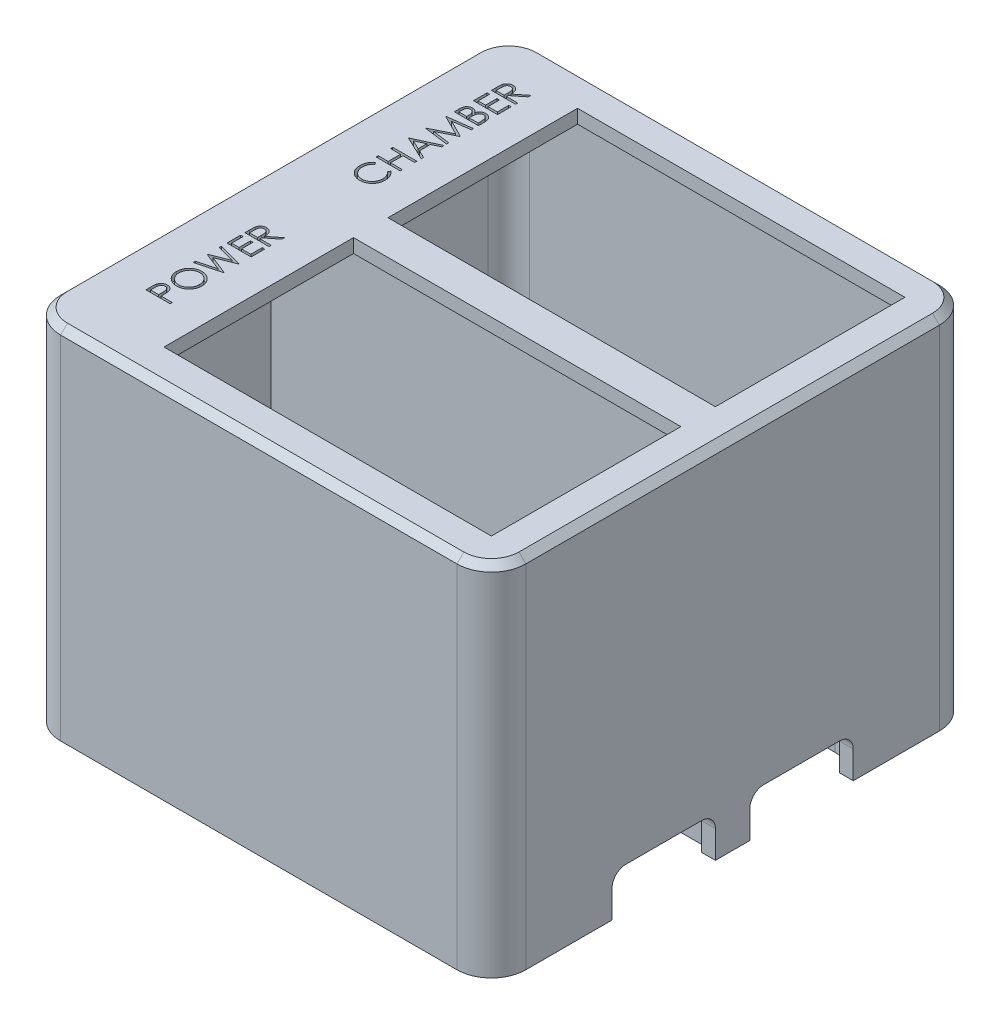
from build123d import *

# Parameters (mm, degrees)
SKETCH2_W           = 67.5
SKETCH2_H           = 70
SKETCH2_W_2         = 47.5
SKETCH2_H_2         = 27.5
BOSS_EXTRUDE1_DEPTH = 2
SKETCH3_W           = 67.5
SKETCH3_H           = 70
SKETCH3_W_2         = 63.5
SKETCH3_H_2         = 31.5
BOSS_EXTRUDE2_DEPTH = 50
FILLET1_R           = 3
FILLET2_R           = 5
SKETCH4_W           = 15
SKETCH4_H           = 6
CUT_EXTRUDE1_DEPTH  = 4
CHAMFER1_SIZE       = 1
SKETCH6_W           = 15
SKETCH6_H           = 8
SKETCH6_R           = 1.75
BOSS_EXTRUDE3_DEPTH = 2.5
FILLET4_START       = -51
FILLET4_DEPTH       = 4
FILLET4_START_2     = -50
FILLET4_2_DEPTH     = 2.5
CUT_EXTRUDE2_DEPTH  = 1
FILLET5_R           = 2


with BuildPart() as part:
    # Sketch2 → Boss-Extrude1 (new body)
    with BuildSketch(Plane(origin=(0, 0, 0), x_dir=(1, 0, 0), z_dir=(0, 1, 0))):
        Rectangle(SKETCH2_W, SKETCH2_H)
        with Locations((5, -16.25)):
            Rectangle(SKETCH2_W_2, SKETCH2_H_2, mode=Mode.SUBTRACT)
        with Locations((5, 16.25)):
            Rectangle(SKETCH2_W_2, SKETCH2_H_2, mode=Mode.SUBTRACT)
    extrude(amount=BOSS_EXTRUDE1_DEPTH)

    # Sketch3 → Boss-Extrude2 (add)
    with BuildSketch(Plane.XZ):
        Rectangle(SKETCH3_W, SKETCH3_H)
        with Locations((0, -17.25)):
            Rectangle(SKETCH3_W_2, SKETCH3_H_2, mode=Mode.SUBTRACT)
        with Locations((0, 17.25)):
            Rectangle(SKETCH3_W_2, SKETCH3_H_2, mode=Mode.SUBTRACT)
    extrude(amount=BOSS_EXTRUDE2_DEPTH)

    # Fillet1
    fillet1_edges = [part.edges().sort_by_distance(p)[0] for p in [
        (-31.75, -25, -33),
        (31.75, -25, -33),
        (31.75, -25, 33),
        (-31.75, -25, 33),
    ]]
    fillet(fillet1_edges, radius=FILLET1_R)

    # Fillet2
    fillet2_edges = [part.edges().sort_by_distance(p)[0] for p in [
        (33.75, -24, 35),
        (-33.75, -24, 35),
        (-33.75, -24, -35),
        (33.75, -24, -35),
    ]]
    fillet(fillet2_edges, radius=FILLET2_R)

    # Sketch4 → Cut-Extrude1 (cut)
    with BuildSketch(Plane(origin=(33.75, 0, 1.75), x_dir=(0, 0, 1), z_dir=(-1, 0, 0))):
        with Locations((8.25, -47)):
            Rectangle(SKETCH4_W, SKETCH4_H)
        with Locations((-11.75, -47)):
            Rectangle(SKETCH4_W, SKETCH4_H)
    extrude(amount=CUT_EXTRUDE1_DEPTH, mode=Mode.SUBTRACT)

    # Chamfer1
    chamfer1_edges = [part.edges().sort_by_distance(p)[0] for p in [
        (0, 2, 35),
        (-33.75, 2, 0),
        (33.75, 2, 0),
        (0, 2, -35),
        (32.285533906, 2, 33.535533906),
        (32.285533906, 2, -33.535533906),
        (-32.285533906, 2, -33.535533906),
        (-32.285533906, 2, 33.535533906),
    ]]
    chamfer(chamfer1_edges, length=CHAMFER1_SIZE)

    # Sketch6 → Boss-Extrude3 (add)
    # profile 1 of 2: a face of its own
    with BuildSketch(Plane.XZ.offset(50)):
        with Locations((-26.25, 23.75)):
            Rectangle(SKETCH6_W, SKETCH6_H)
        with Locations(Location((-23.75, 23.75, 0), (0, 0, 270))):
            Circle(SKETCH6_R, mode=Mode.SUBTRACT)
    # profile 2 of 2: a face of its own
    with BuildSketch(Plane.XZ.offset(50)):
        with Locations((26.25, 23.75)):
            Rectangle(SKETCH6_W, SKETCH6_H)
        with Locations(Location((23.75, 23.75, 0), (0, 0, 270))):
            Circle(SKETCH6_R, mode=Mode.SUBTRACT)
    boss_extrude3 = extrude(amount=-BOSS_EXTRUDE3_DEPTH)

    # Mirror1: Boss-Extrude3 across plane
    add(boss_extrude3.mirror(Plane.XY))

    # Fillet4: read off the stored shape, not the designer's step
    # Fillet4 outline → Fillet4 (cut)
    with BuildSketch(Plane(origin=(0, 0, 0), x_dir=(1, 0, 0), z_dir=(0, 1, 0)).offset(FILLET4_START)):
        with BuildLine():
            Line((18.75, 19.75), (21.75, 19.75))
            ThreePointArc((21.75, 19.75), (19.628679656, 20.628679656), (18.75, 22.75))
            Line((18.75, 22.75), (18.75, 19.75))
        make_face()
        with BuildLine():
            Line((18.75, 27.75), (18.75, 24.75))
            ThreePointArc((18.75, 24.75), (19.628679656, 26.871320344), (21.75, 27.75))
            Line((21.75, 27.75), (18.75, 27.75))
        make_face()
        with BuildLine():
            Line((-18.75, 27.75), (-21.75, 27.75))
            ThreePointArc((-21.75, 27.75), (-19.628679656, 26.871320344), (-18.75, 24.75))
            Line((-18.75, 24.75), (-18.75, 27.75))
        make_face()
        with BuildLine():
            Line((-18.75, 19.75), (-18.75, 22.75))
            ThreePointArc((-18.75, 22.75), (-19.628679656, 20.628679656), (-21.75, 19.75))
            Line((-21.75, 19.75), (-18.75, 19.75))
        make_face()
        with BuildLine():
            ThreePointArc((18.75, -22.75), (19.628679656, -20.628679656), (21.75, -19.75))
            Line((21.75, -19.75), (18.75, -19.75))
            Line((18.75, -19.75), (18.75, -22.75))
        make_face()
        with BuildLine():
            ThreePointArc((21.75, -27.75), (19.628679656, -26.871320344), (18.75, -24.75))
            Line((18.75, -24.75), (18.75, -27.75))
            Line((18.75, -27.75), (21.75, -27.75))
        make_face()
        with BuildLine():
            ThreePointArc((-21.75, -19.75), (-19.628679656, -20.628679656), (-18.75, -22.75))
            Line((-18.75, -22.75), (-18.75, -19.75))
            Line((-18.75, -19.75), (-21.75, -19.75))
        make_face()
        with BuildLine():
            Line((-18.75, -27.75), (-18.75, -24.75))
            ThreePointArc((-18.75, -24.75), (-19.628679656, -26.871320344), (-21.75, -27.75))
            Line((-21.75, -27.75), (-18.75, -27.75))
        make_face()
    extrude(amount=FILLET4_DEPTH, mode=Mode.SUBTRACT)

    # Fillet4 2 outline → Fillet4 2 (add)
    with BuildSketch(Plane(origin=(0, 0, 0), x_dir=(1, 0, 0), z_dir=(0, 1, 0)).offset(FILLET4_START_2)):
        with BuildLine():
            ThreePointArc((28.84526249, 19.75), (30.682379797, 19.121708245), (31.75, 17.5))
            Line((31.75, 17.5), (31.75, 19.75))
            Line((31.75, 19.75), (28.84526249, 19.75))
        make_face()
        with BuildLine():
            Line((28.84526249, 27.75), (31.75, 27.75))
            Line((31.75, 27.75), (31.75, 30))
            ThreePointArc((31.75, 30), (30.682379797, 28.378291755), (28.84526249, 27.75))
        make_face()
        with BuildLine():
            ThreePointArc((-28.84526249, 27.75), (-30.682379797, 28.378291755), (-31.75, 30))
            Line((-31.75, 30), (-31.75, 27.75))
            Line((-31.75, 27.75), (-28.84526249, 27.75))
        make_face()
        with BuildLine():
            Line((-28.75, 19.75), (-31.75, 19.75))
            Line((-31.75, 19.75), (-31.75, 16.75))
            ThreePointArc((-31.75, 16.75), (-30.871320344, 18.871320344), (-28.75, 19.75))
        make_face()
        with BuildLine():
            Line((31.75, -19.75), (31.75, -17.5))
            ThreePointArc((31.75, -17.5), (30.682379797, -19.121708245), (28.84526249, -19.75))
            Line((28.84526249, -19.75), (31.75, -19.75))
        make_face()
        with BuildLine():
            Line((31.75, -30), (31.75, -27.75))
            Line((31.75, -27.75), (28.84526249, -27.75))
            ThreePointArc((28.84526249, -27.75), (30.682379797, -28.378291755), (31.75, -30))
        make_face()
        with BuildLine():
            Line((-31.75, -19.75), (-28.75, -19.75))
            ThreePointArc((-28.75, -19.75), (-30.871320344, -18.871320344), (-31.75, -16.75))
            Line((-31.75, -16.75), (-31.75, -19.75))
        make_face()
        with BuildLine():
            ThreePointArc((-31.75, -30), (-30.682379797, -28.378291755), (-28.84526249, -27.75))
            Line((-28.84526249, -27.75), (-31.75, -27.75))
            Line((-31.75, -27.75), (-31.75, -30))
        make_face()
    extrude(amount=FILLET4_2_DEPTH)

    # Sketch7 → Cut-Extrude2 (cut)
    # profile 1 of 12: a face of its own
    with BuildSketch(Plane(origin=(0, 2, 0), x_dir=(1, 0, 0), z_dir=(0, 1, 0))):
        with BuildLine():
            Line((-27.25, 26.003205128), (-27.25, 26.703625801))
            add(Edge.make_bspline(
                [(-27.25, 26.703625801), (-27.249844414, 26.75036693), (-27.249545672, 26.840115074), (-27.247879909, 26.968688345), (-27.243105553, 27.085515442), (-27.23899697, 27.190535281), (-27.231505028, 27.283745936), (-27.224344381, 27.365433227), (-27.21497072, 27.435220924), (-27.206265297, 27.477466775), (-27.202323718, 27.496594551)],
                knots=[0, 0, 0, 0, 1.410062039, 2.707475311, 3.878576406, 4.937260626, 5.877586885, 6.699081471, 7.410979367, 8, 8, 8, 8], degree=3))
            add(Edge.make_bspline(
                [(-27.202323718, 27.496594551), (-27.195996936, 27.522201156), (-27.183478338, 27.572868106), (-27.157018985, 27.64581846), (-27.126398448, 27.715331719), (-27.090438053, 27.781125429), (-27.048850926, 27.842846791), (-27.002429037, 27.901219129), (-26.951266149, 27.956052964), (-26.894901045, 28.006632669), (-26.834534666, 28.052576801), (-26.770332688, 28.092876881), (-26.702560575, 28.126929708), (-26.631112765, 28.153652436), (-26.556778508, 28.176075742), (-26.478799111, 28.191141441), (-26.397434893, 28.200525899), (-26.342073564, 28.201452991), (-26.314002404, 28.201923077)],
                knots=[0, 0, 0, 0, 1.02737844, 2.032840108, 3.019645024, 3.985760442, 4.950801802, 5.916702504, 6.889791722, 7.870143693, 8.864820395, 9.842884691, 10.820524757, 11.815201459, 12.812418953, 13.84314332, 14.906358105, 16, 16, 16, 16], degree=3))
            add(Edge.make_bspline(
                [(-26.314002404, 28.201923077), (-26.267367299, 28.200454079), (-26.176370131, 28.197587683), (-26.04430925, 28.170862579), (-25.921119935, 28.12708606), (-25.806957297, 28.066762771), (-25.704046652, 27.989943295), (-25.613656197, 27.897618504), (-25.538016284, 27.789736892), (-25.485563479, 27.689307576), (-25.451970571, 27.600593377), (-25.428334212, 27.527560064), (-25.410072247, 27.447893086), (-25.393712115, 27.362355752), (-25.38136042, 27.270592096), (-25.372313826, 27.172822057), (-25.366659777, 27.068975905), (-25.365817772, 26.997636836), (-25.365384615, 26.9609375)],
                knots=[0, 0, 0, 0, 1.260483769, 2.459530307, 3.627416485, 4.787058657, 5.939039949, 7.08810263, 8.267026773, 9.491475466, 10.141966685, 10.831826277, 11.566392101, 12.351337768, 13.187381173, 14.07005841, 15.007169909, 16, 16, 16, 16], degree=3))
            Line((-25.365384615, 26.9609375), (-23.75, 28.246794872))
            Line((-23.75, 28.246794872), (-23.75, 27.858373397))
            Line((-23.75, 27.858373397), (-25.365384615, 26.572516026))
            Line((-25.365384615, 26.572516026), (-25.365384615, 26.317307692))
            Line((-25.365384615, 26.317307692), (-23.75, 26.317307692))
            Line((-23.75, 26.317307692), (-23.75, 26.003205128))
            Line((-23.75, 26.003205128), (-27.25, 26.003205128))
        make_face()
        with BuildLine():
            Line((-26.891025641, 26.317307692), (-25.724358974, 26.317307692))
            Line((-25.724358974, 26.317307692), (-25.719451122, 26.958133013))
            add(Edge.make_bspline(
                [(-25.719451122, 26.958133013), (-25.719437877, 26.988053056), (-25.719412206, 27.04604662), (-25.723406086, 27.129947232), (-25.72794905, 27.208067524), (-25.734899579, 27.280107677), (-25.743851764, 27.34610322), (-25.755067425, 27.406010213), (-25.768078178, 27.459962187), (-25.788424454, 27.522682008), (-25.819251682, 27.593546388), (-25.867131907, 27.668876742), (-25.924663519, 27.734973084), (-25.992349925, 27.788803646), (-26.06558868, 27.833904886), (-26.145129884, 27.864256227), (-26.228393298, 27.884484107), (-26.285601748, 27.886695555), (-26.314703526, 27.887820513)],
                knots=[0, 0, 0, 0, 1.146477201, 2.22219935, 3.21835465, 4.145220026, 4.995151787, 5.769831222, 6.480173269, 7.120302478, 8.295254187, 9.430763426, 10.528629691, 11.636497428, 12.733230534, 13.811001502, 14.886462612, 16, 16, 16, 16], degree=3))
            add(Edge.make_bspline(
                [(-26.314703526, 27.887820513), (-26.342847804, 27.886614922), (-26.398619495, 27.884225881), (-26.480309052, 27.864827979), (-26.557431576, 27.831665325), (-26.630086643, 27.788039707), (-26.695007947, 27.73328937), (-26.751158697, 27.670324838), (-26.797125816, 27.59915823), (-26.827677228, 27.533229217), (-26.845618725, 27.473828496), (-26.858659167, 27.42249946), (-26.86770972, 27.364217383), (-26.876282244, 27.299247313), (-26.883221934, 27.227465257), (-26.888008837, 27.148660831), (-26.890812263, 27.063322201), (-26.89095286, 27.004175537), (-26.891025641, 26.973557692)],
                knots=[0, 0, 0, 0, 1.100823979, 2.181431445, 3.263702604, 4.376021382, 5.48638238, 6.575013887, 7.666064109, 8.791843368, 9.405226397, 10.093019944, 10.863016055, 11.711746407, 12.658404307, 13.684961631, 14.801597923, 16, 16, 16, 16], degree=3))
            Line((-26.891025641, 26.973557692), (-26.891025641, 26.317307692))
        make_face(mode=Mode.SUBTRACT)
    # profile 2 of 12: a face of its own
    with BuildSketch(Plane(origin=(0, 2, 0), x_dir=(1, 0, 0), z_dir=(0, 1, 0))):
        Polygon((-27.25, 23.400641026), (-27.25, 25.375), (-26.891025641, 25.375), (-26.891025641, 23.71474359), (-25.814102564, 23.71474359), (-25.814102564, 25.375), (-25.455128205, 25.375), (-25.455128205, 23.71474359), (-24.108974359, 23.71474359), (-24.108974359, 25.375), (-23.75, 25.375), (-23.75, 23.400641026), align=None)
    # profile 3 of 12: a face of its own
    with BuildSketch(Plane(origin=(0, 2, 0), x_dir=(1, 0, 0), z_dir=(0, 1, 0))):
        with BuildLine():
            Line((-27.25, 20.618589744), (-27.25, 21.301482372))
            add(Edge.make_bspline(
                [(-27.25, 21.301482372), (-27.249827016, 21.334911377), (-27.249491731, 21.399705109), (-27.244170998, 21.493917387), (-27.237097587, 21.582191017), (-27.22523232, 21.664370009), (-27.212929603, 21.74098909), (-27.19487216, 21.811270415), (-27.174927056, 21.875802678), (-27.144238808, 21.953292717), (-27.096579571, 22.041215784), (-27.025896393, 22.135716629), (-26.941152971, 22.21786253), (-26.844581157, 22.287710896), (-26.738341218, 22.343765695), (-26.624718941, 22.383805829), (-26.505625884, 22.409529137), (-26.423976582, 22.412141362), (-26.38271234, 22.413461538)],
                knots=[0, 0, 0, 0, 1.00128172, 1.940733171, 2.826250472, 3.653024905, 4.427672124, 5.149348099, 5.824709082, 6.450061444, 7.643590664, 8.808605388, 9.972104426, 11.165284501, 12.367876273, 13.557044126, 14.765369432, 16, 16, 16, 16], degree=3))
            add(Edge.make_bspline(
                [(-26.38271234, 22.413461538), (-26.344061484, 22.412361928), (-26.268108906, 22.410201089), (-26.157211066, 22.389790119), (-26.051753702, 22.357394992), (-25.951827071, 22.312623619), (-25.859291316, 22.254938211), (-25.774433087, 22.185822983), (-25.700459558, 22.10278159), (-25.659119745, 22.040533481), (-25.638120994, 22.008914263)],
                knots=[0, 0, 0, 0, 1.044641374, 2.052818814, 3.038628718, 4.023282556, 5.005660861, 5.98021751, 6.974042014, 8, 8, 8, 8], degree=3))
            add(Edge.make_bspline(
                [(-25.638120994, 22.008914263), (-25.622851052, 22.048670851), (-25.59363587, 22.124735053), (-25.542064534, 22.229470875), (-25.48576949, 22.319378362), (-25.425242264, 22.396213811), (-25.359038135, 22.461580888), (-25.286619226, 22.518192558), (-25.208044822, 22.567134449), (-25.12360371, 22.60878366), (-25.034011735, 22.641499634), (-24.940363175, 22.665545422), (-24.843017032, 22.679769028), (-24.776955989, 22.681709346), (-24.743489583, 22.682692308)],
                knots=[0, 0, 0, 0, 1.272586185, 2.434772614, 3.483318042, 4.437947805, 5.351807173, 6.25737843, 7.180033415, 8.1141739, 9.066731021, 10.025721652, 10.999834114, 12, 12, 12, 12], degree=3))
            add(Edge.make_bspline(
                [(-24.743489583, 22.682692308), (-24.709322572, 22.681715675), (-24.64209802, 22.679794123), (-24.543344872, 22.665611102), (-24.448962627, 22.641613203), (-24.358384297, 22.608500819), (-24.271799795, 22.565581658), (-24.189522785, 22.512595551), (-24.111382093, 22.450286317), (-24.03723981, 22.379866811), (-23.96939729, 22.30138978), (-23.911075602, 22.214903041), (-23.860927262, 22.12277591), (-23.820098271, 22.023830628), (-23.788598733, 21.918319782), (-23.766652218, 21.806302085), (-23.751839877, 21.687962013), (-23.750623699, 21.606751667), (-23.75, 21.565104167)],
                knots=[0, 0, 0, 0, 0.978680899, 1.925582087, 2.851223405, 3.764209995, 4.683484765, 5.614004905, 6.562443559, 7.542772147, 8.539900013, 9.527881485, 10.525548727, 11.540192123, 12.58875426, 13.674701727, 14.807505862, 16, 16, 16, 16], degree=3))
            Line((-23.75, 21.565104167), (-23.75, 20.618589744))
            Line((-23.75, 20.618589744), (-27.25, 20.618589744))
        make_face()
        with BuildLine():
            Line((-26.891025641, 20.932692308), (-25.769230769, 20.932692308))
            Line((-25.769230769, 20.932692308), (-25.769230769, 21.143729968))
            add(Edge.make_bspline(
                [(-25.769230769, 21.143729968), (-25.769630692, 21.174578763), (-25.770403425, 21.234184923), (-25.772616943, 21.320504818), (-25.778814983, 21.40062984), (-25.785011254, 21.474421663), (-25.795085813, 21.54176414), (-25.80707803, 21.602507892), (-25.819760632, 21.657606842), (-25.841331398, 21.7211449), (-25.873200398, 21.793227941), (-25.922706503, 21.870021173), (-25.981625018, 21.938034989), (-26.050244736, 21.994780091), (-26.124983675, 22.041631645), (-26.205185698, 22.074452632), (-26.289236842, 22.096333407), (-26.347049479, 22.098340121), (-26.376402244, 22.099358974)],
                knots=[0, 0, 0, 0, 1.156917035, 2.235399477, 3.236897345, 4.169954739, 5.01148057, 5.788325709, 6.491867502, 7.129259015, 8.302032419, 9.437271567, 10.542795419, 11.662606952, 12.764338259, 13.836858145, 14.901724648, 16, 16, 16, 16], degree=3))
            add(Edge.make_bspline(
                [(-26.376402244, 22.099358974), (-26.395830562, 22.098841663), (-26.433941329, 22.097826901), (-26.489678522, 22.089214078), (-26.54205104, 22.075259018), (-26.591561526, 22.056360105), (-26.636979527, 22.030541385), (-26.680475233, 22.000614096), (-26.719443462, 21.96366461), (-26.755760298, 21.921908409), (-26.788263745, 21.874131868), (-26.815187813, 21.81930564), (-26.839589964, 21.758847067), (-26.857654151, 21.691115874), (-26.873538771, 21.617515476), (-26.883519185, 21.537049294), (-26.889941675, 21.450227228), (-26.89065626, 21.39007044), (-26.891025641, 21.358974359)],
                knots=[0, 0, 0, 0, 0.911708768, 1.788416306, 2.640049961, 3.452993646, 4.268229297, 5.087074648, 5.92553149, 6.781184137, 7.681934069, 8.628939405, 9.643570426, 10.73771997, 11.914765019, 13.176320755, 14.540391495, 16, 16, 16, 16], degree=3))
            Line((-26.891025641, 21.358974359), (-26.891025641, 20.932692308))
        make_face(mode=Mode.SUBTRACT)
        with BuildLine():
            Line((-25.41025641, 20.932692308), (-24.108974359, 20.932692308))
            Line((-24.108974359, 20.932692308), (-24.108974359, 21.380008013))
            add(Edge.make_bspline(
                [(-24.108974359, 21.380008013), (-24.109396264, 21.41202359), (-24.11020943, 21.473729394), (-24.112116473, 21.562892135), (-24.119330527, 21.64531656), (-24.125985459, 21.72126269), (-24.137365108, 21.790528963), (-24.148104538, 21.853648179), (-24.164046454, 21.909584193), (-24.185956742, 21.97504227), (-24.221032393, 22.048209271), (-24.272277589, 22.128167632), (-24.335522071, 22.197890085), (-24.407450692, 22.257740301), (-24.485443268, 22.307131299), (-24.568480193, 22.342574012), (-24.654946557, 22.364599378), (-24.713915826, 22.367256944), (-24.743489583, 22.368589744)],
                knots=[0, 0, 0, 0, 1.160376723, 2.23647316, 3.230273494, 4.158083346, 4.997711197, 5.773399541, 6.476071462, 7.102777513, 8.27340052, 9.405620712, 10.53304798, 11.669441455, 12.787990954, 13.865552736, 14.929550474, 16, 16, 16, 16], degree=3))
            add(Edge.make_bspline(
                [(-24.743489583, 22.368589744), (-24.761983322, 22.368314485), (-24.798672494, 22.367768407), (-24.852582506, 22.359495465), (-24.904829834, 22.347527139), (-24.955632199, 22.33176451), (-25.004135426, 22.309729204), (-25.050525527, 22.282715766), (-25.095737015, 22.251794086), (-25.153634242, 22.204087784), (-25.219513255, 22.133685451), (-25.283216158, 22.03363588), (-25.33542007, 21.920504089), (-25.35748965, 21.838258951), (-25.368890224, 21.795773237)],
                knots=[0, 0, 0, 0, 0.723302347, 1.434937762, 2.129609326, 2.821140842, 3.513216847, 4.209993937, 4.920569932, 5.655069131, 7.14393391, 8.6716197, 10.280644748, 12, 12, 12, 12], degree=3))
            add(Edge.make_bspline(
                [(-25.368890224, 21.795773237), (-25.372345308, 21.778744141), (-25.379836643, 21.741821549), (-25.387744346, 21.681613969), (-25.394789406, 21.6128781), (-25.400000564, 21.535455222), (-25.405387107, 21.449247381), (-25.407481929, 21.354070463), (-25.409981189, 21.250313148), (-25.410162323, 21.178320776), (-25.41025641, 21.140925481)],
                knots=[0, 0, 0, 0, 0.634451884, 1.375622551, 2.216452059, 3.157844607, 4.20941857, 5.370758133, 6.634282058, 8, 8, 8, 8], degree=3))
            Line((-25.41025641, 21.140925481), (-25.41025641, 20.932692308))
        make_face(mode=Mode.SUBTRACT)
    # profile 4 of 12: a face of its own
    with BuildSketch(Plane(origin=(0, 2, 0), x_dir=(1, 0, 0), z_dir=(0, 1, 0))):
        Polygon((-23.75, 15.996794872), (-27.25, 16.458834135), (-27.25, 16.503705929), (-24.378205128, 17.948717949), (-27.25, 19.390224359), (-27.25, 19.435797276), (-23.75, 19.900641026), (-23.75, 19.585136218), (-26.268429487, 19.25), (-23.75, 17.986578526), (-23.75, 17.915765224), (-26.274038462, 16.647435897), (-23.75, 16.313000801), align=None)
    # profile 5 of 12: a face of its own
    with BuildSketch(Plane(origin=(0, 2, 0), x_dir=(1, 0, 0), z_dir=(0, 1, 0))):
        Polygon((-27.25, 14.022435897), (-23.75, 15.637820513), (-23.75, 15.296374199), (-24.871794872, 14.778946314), (-24.871794872, 13.192307692), (-23.75, 12.66015625), (-23.75, 12.317307692), (-27.25, 13.977564103), align=None)
        Polygon((-26.567808494, 13.996494391), (-25.230769231, 13.362680288), (-25.230769231, 14.613481571), align=None, mode=Mode.SUBTRACT)
    # profile 6 of 12: a face of its own
    with BuildSketch(Plane(origin=(0, 2, 0), x_dir=(1, 0, 0), z_dir=(0, 1, 0))):
        Polygon((-27.25, 9.266025641), (-27.25, 9.580128205), (-25.814102564, 9.580128205), (-25.814102564, 11.375), (-27.25, 11.375), (-27.25, 11.689102564), (-23.75, 11.689102564), (-23.75, 11.375), (-25.455128205, 11.375), (-25.455128205, 9.580128205), (-23.75, 9.580128205), (-23.75, 9.266025641), align=None)
    # profile 7 of 12: a face of its own
    with BuildSketch(Plane(origin=(0, 2, 0), x_dir=(1, 0, 0), z_dir=(0, 1, 0))):
        with BuildLine():
            Line((-26.607772436, 8.548076923), (-26.397435897, 8.273237179))
            add(Edge.make_bspline(
                [(-26.397435897, 8.273237179), (-26.420801558, 8.25363109), (-26.46721786, 8.214683244), (-26.532401946, 8.152026995), (-26.593450218, 8.086714303), (-26.65075492, 8.01883604), (-26.702012856, 7.946821348), (-26.751216038, 7.873414189), (-26.794295117, 7.795947355), (-26.846921601, 7.689369492), (-26.900639943, 7.549403834), (-26.946842354, 7.373818992), (-26.975976532, 7.190273174), (-26.979153365, 7.06508036), (-26.980769231, 7.001402244)],
                knots=[0, 0, 0, 0, 0.75789156, 1.505565099, 2.245254514, 2.979266606, 3.711207489, 4.440978832, 5.174393176, 5.91211879, 7.394186119, 8.890401545, 10.418332761, 12, 12, 12, 12], degree=3))
            add(Edge.make_bspline(
                [(-26.980769231, 7.001402244), (-26.980365268, 6.966318944), (-26.979561092, 6.896477952), (-26.968951967, 6.792829478), (-26.954040757, 6.691116427), (-26.931915434, 6.591404961), (-26.903942816, 6.493822001), (-26.870517398, 6.397729604), (-26.829162571, 6.304518988), (-26.783454265, 6.212900811), (-26.731826989, 6.125121373), (-26.675513027, 6.042067146), (-26.615146153, 5.964036186), (-26.550486887, 5.890984562), (-26.481875034, 5.82277207), (-26.408541914, 5.760257066), (-26.331271482, 5.702604301), (-26.249999569, 5.650142349), (-26.165483096, 5.602914409), (-26.077239526, 5.563203056), (-25.986779766, 5.528519428), (-25.893462522, 5.500642792), (-25.797908028, 5.478749357), (-25.699720428, 5.463613244), (-25.599085882, 5.453127071), (-25.530876687, 5.452326581), (-25.496494391, 5.451923077)],
                knots=[0, 0, 0, 0, 1.054877232, 2.099964208, 3.13098259, 4.145888998, 5.169474743, 6.183358035, 7.203388855, 8.234598956, 9.261847606, 10.264062591, 11.251197969, 12.227332808, 13.196685059, 14.158975844, 15.123498106, 16.094582253, 17.066912473, 18.032714859, 19.002806091, 19.979168736, 20.95977404, 21.949109834, 22.966205168, 24, 24, 24, 24], degree=3))
            add(Edge.make_bspline(
                [(-25.496494391, 5.451923077), (-25.444764224, 5.453187855), (-25.343198904, 5.455671078), (-25.194411923, 5.477677411), (-25.051737065, 5.511386801), (-24.916140367, 5.561080843), (-24.786491469, 5.623578984), (-24.664362627, 5.701559431), (-24.547964618, 5.792216276), (-24.440116535, 5.896479541), (-24.341604203, 6.010888382), (-24.254853252, 6.133635492), (-24.182538467, 6.264419992), (-24.122362494, 6.401796565), (-24.076105774, 6.546822694), (-24.043541649, 6.699237492), (-24.022299469, 6.858709489), (-24.02026578, 6.967678889), (-24.019230769, 7.023137019)],
                knots=[0, 0, 0, 0, 1.029159485, 2.020618137, 2.987588728, 3.942669054, 4.889339625, 5.846988364, 6.821327795, 7.821533711, 8.827683044, 9.822769455, 10.807800696, 11.797391277, 12.803701919, 13.832062008, 14.896664671, 16, 16, 16, 16], degree=3))
            add(Edge.make_bspline(
                [(-24.019230769, 7.023137019), (-24.020919549, 7.084239708), (-24.024243472, 7.204504417), (-24.052402721, 7.380872443), (-24.098060638, 7.549708209), (-24.161958561, 7.711020796), (-24.245023849, 7.864355442), (-24.345721726, 8.009952102), (-24.465010059, 8.147933673), (-24.556093187, 8.230904955), (-24.602564103, 8.273237179)],
                knots=[0, 0, 0, 0, 1.028121516, 2.023589091, 2.998037872, 3.967518031, 4.937445131, 5.927275754, 6.942489185, 8, 8, 8, 8], degree=3))
            Line((-24.602564103, 8.273237179), (-24.394330929, 8.548076923))
            add(Edge.make_bspline(
                [(-24.394330929, 8.548076923), (-24.365793465, 8.525958038), (-24.308855229, 8.481826215), (-24.228568872, 8.4103797), (-24.153119557, 8.335059434), (-24.082884076, 8.255671812), (-24.017571714, 8.172076908), (-23.957146992, 8.084282394), (-23.901930584, 7.99236321), (-23.851211602, 7.897049461), (-23.806555258, 7.798121514), (-23.766983214, 7.696450275), (-23.734221933, 7.591412356), (-23.706509565, 7.483891942), (-23.686749399, 7.372917973), (-23.671013952, 7.259780438), (-23.661678518, 7.143420409), (-23.660734699, 7.064987119), (-23.66025641, 7.025240385)],
                knots=[0, 0, 0, 0, 0.986911346, 1.969095443, 2.935967484, 3.900112155, 4.865124501, 5.834589912, 6.812044781, 7.795288262, 8.784678562, 9.777857908, 10.776141921, 11.791195789, 12.811324908, 13.855933174, 14.913475973, 16, 16, 16, 16], degree=3))
            add(Edge.make_bspline(
                [(-23.66025641, 7.025240385), (-23.660518403, 6.987596718), (-23.661036461, 6.913161027), (-23.669428628, 6.803262276), (-23.680878365, 6.696272695), (-23.698118496, 6.592498069), (-23.718462836, 6.491372094), (-23.745734093, 6.39381151), (-23.776283259, 6.298856299), (-23.812188246, 6.206887959), (-23.852704429, 6.117828259), (-23.898495987, 6.031964447), (-23.949177852, 5.949336015), (-24.003632863, 5.869130594), (-24.063610164, 5.79253301), (-24.128276799, 5.718879485), (-24.19741481, 5.647757009), (-24.247269663, 5.603754324), (-24.272335737, 5.581630609)],
                knots=[0, 0, 0, 0, 1.114604814, 2.203992996, 3.262667896, 4.300477797, 5.318619304, 6.316056647, 7.298880507, 8.271930387, 9.238335007, 10.195173496, 11.151986948, 12.108099108, 13.064862484, 14.031167946, 15.010108607, 16, 16, 16, 16], degree=3))
            add(Edge.make_bspline(
                [(-24.272335737, 5.581630609), (-24.315877824, 5.546197277), (-24.40243632, 5.475758395), (-24.542709076, 5.385598681), (-24.689035305, 5.308679768), (-24.842262553, 5.24579375), (-25.002450387, 5.197489953), (-25.169341112, 5.163529243), (-25.342601104, 5.141614448), (-25.460436232, 5.139099086), (-25.520332532, 5.137820513)],
                knots=[0, 0, 0, 0, 0.994611881, 1.977215934, 2.950189954, 3.921972279, 4.908960509, 5.911694611, 6.938501887, 8, 8, 8, 8], degree=3))
            add(Edge.make_bspline(
                [(-25.520332532, 5.137820513), (-25.583287986, 5.139375706), (-25.70714891, 5.142435453), (-25.888922863, 5.168431248), (-26.063074262, 5.210250044), (-26.229278007, 5.269646933), (-26.388408287, 5.344952284), (-26.539249492, 5.437978898), (-26.682766292, 5.54764604), (-26.816781043, 5.673093608), (-26.939320396, 5.810660943), (-27.047126599, 5.957979757), (-27.136844115, 6.114761704), (-27.211840278, 6.279279556), (-27.269484741, 6.452765237), (-27.309837928, 6.634848606), (-27.334955044, 6.825187521), (-27.338130252, 6.955049947), (-27.33974359, 7.021033654)],
                knots=[0, 0, 0, 0, 1.032925535, 2.032216505, 3.007276963, 3.968222605, 4.92396291, 5.891752235, 6.871517503, 7.883894988, 8.900124299, 9.891468569, 10.874487609, 11.85992873, 12.854644235, 13.869047385, 14.917252991, 16, 16, 16, 16], degree=3))
            add(Edge.make_bspline(
                [(-27.33974359, 7.021033654), (-27.339261032, 7.061247994), (-27.338305858, 7.14084823), (-27.329005794, 7.258602794), (-27.313469843, 7.373238092), (-27.292435185, 7.484874685), (-27.265946277, 7.593835323), (-27.232932614, 7.699916157), (-27.193627527, 7.802857423), (-27.14874294, 7.902625679), (-27.098270478, 7.998547434), (-27.04280548, 8.090562469), (-26.982628195, 8.178303946), (-26.917122545, 8.261315823), (-26.84683189, 8.339699661), (-26.772579589, 8.414618214), (-26.69246027, 8.483890674), (-26.636053389, 8.526642341), (-26.607772436, 8.548076923)],
                knots=[0, 0, 0, 0, 1.096622143, 2.170653093, 3.219033441, 4.250379162, 5.267604342, 6.275621678, 7.278284436, 8.271072515, 9.257558938, 10.232633088, 11.19973724, 12.157384997, 13.114417402, 14.069920322, 15.032307892, 16, 16, 16, 16], degree=3))
        make_face()
    # profile 8 of 12: a face of its own
    with BuildSketch(Plane(origin=(0, 2, 0), x_dir=(1, 0, 0), z_dir=(0, 1, 0))):
        with BuildLine():
            Line((-27.25, -9.759615385), (-27.25, -9.059194712))
            add(Edge.make_bspline(
                [(-27.25, -9.059194712), (-27.249844414, -9.012453583), (-27.249545672, -8.922705439), (-27.247879909, -8.794132168), (-27.243105553, -8.677305071), (-27.23899697, -8.572285232), (-27.231505028, -8.479074577), (-27.224344381, -8.397387286), (-27.21497072, -8.327599589), (-27.206265297, -8.285353737), (-27.202323718, -8.266225962)],
                knots=[0, 0, 0, 0, 1.410062039, 2.707475311, 3.878576406, 4.937260626, 5.877586885, 6.699081471, 7.410979367, 8, 8, 8, 8], degree=3))
            add(Edge.make_bspline(
                [(-27.202323718, -8.266225962), (-27.195996936, -8.240619357), (-27.183478338, -8.189952407), (-27.157018985, -8.117002052), (-27.126398448, -8.047488794), (-27.090438053, -7.981695084), (-27.048850926, -7.919973722), (-27.002429037, -7.861601384), (-26.951266149, -7.806767549), (-26.894901045, -7.756187844), (-26.834534666, -7.710243712), (-26.770332688, -7.669943632), (-26.702560575, -7.635890805), (-26.631112765, -7.609168076), (-26.556778508, -7.586744771), (-26.478799111, -7.571679072), (-26.397434893, -7.562294614), (-26.342073564, -7.561367521), (-26.314002404, -7.560897436)],
                knots=[0, 0, 0, 0, 1.02737844, 2.032840108, 3.019645024, 3.985760442, 4.950801802, 5.916702504, 6.889791722, 7.870143693, 8.864820395, 9.842884691, 10.820524757, 11.815201459, 12.812418953, 13.84314332, 14.906358105, 16, 16, 16, 16], degree=3))
            add(Edge.make_bspline(
                [(-26.314002404, -7.560897436), (-26.267367299, -7.562366434), (-26.176370131, -7.56523283), (-26.04430925, -7.591957933), (-25.921119935, -7.635734453), (-25.806957297, -7.696057742), (-25.704046652, -7.772877218), (-25.613656197, -7.865202009), (-25.538016284, -7.973083621), (-25.485563479, -8.073512936), (-25.451970571, -8.162227136), (-25.428334212, -8.235260449), (-25.410072247, -8.314927426), (-25.393712115, -8.400464761), (-25.38136042, -8.492228417), (-25.372313826, -8.589998456), (-25.366659777, -8.693844608), (-25.365817772, -8.765183677), (-25.365384615, -8.801883013)],
                knots=[0, 0, 0, 0, 1.260483769, 2.459530307, 3.627416485, 4.787058657, 5.939039949, 7.08810263, 8.267026773, 9.491475466, 10.141966685, 10.831826277, 11.566392101, 12.351337768, 13.187381173, 14.07005841, 15.007169909, 16, 16, 16, 16], degree=3))
            Line((-25.365384615, -8.801883013), (-23.75, -7.516025641))
            Line((-23.75, -7.516025641), (-23.75, -7.904447115))
            Line((-23.75, -7.904447115), (-25.365384615, -9.190304487))
            Line((-25.365384615, -9.190304487), (-25.365384615, -9.445512821))
            Line((-25.365384615, -9.445512821), (-23.75, -9.445512821))
            Line((-23.75, -9.445512821), (-23.75, -9.759615385))
            Line((-23.75, -9.759615385), (-27.25, -9.759615385))
        make_face()
        with BuildLine():
            Line((-26.891025641, -9.445512821), (-25.724358974, -9.445512821))
            Line((-25.724358974, -9.445512821), (-25.719451122, -8.8046875))
            add(Edge.make_bspline(
                [(-25.719451122, -8.8046875), (-25.719437877, -8.774767457), (-25.719412206, -8.716773892), (-25.723406086, -8.63287328), (-25.72794905, -8.554752989), (-25.734899579, -8.482712836), (-25.743851764, -8.416717292), (-25.755067425, -8.356810299), (-25.768078178, -8.302858326), (-25.788424454, -8.240138505), (-25.819251682, -8.169274125), (-25.867131907, -8.093943771), (-25.924663519, -8.027847429), (-25.992349925, -7.974016867), (-26.06558868, -7.928915627), (-26.145129884, -7.898564286), (-26.228393298, -7.878336405), (-26.285601748, -7.876124957), (-26.314703526, -7.875)],
                knots=[0, 0, 0, 0, 1.146477201, 2.22219935, 3.21835465, 4.145220026, 4.995151787, 5.769831222, 6.480173269, 7.120302478, 8.295254187, 9.430763426, 10.528629691, 11.636497428, 12.733230534, 13.811001502, 14.886462612, 16, 16, 16, 16], degree=3))
            add(Edge.make_bspline(
                [(-26.314703526, -7.875), (-26.342847804, -7.876205591), (-26.398619495, -7.878594632), (-26.480309052, -7.897992534), (-26.557431576, -7.931155188), (-26.630086643, -7.974780806), (-26.695007947, -8.029531143), (-26.751158697, -8.092495674), (-26.797125816, -8.163662283), (-26.827677228, -8.229591296), (-26.845618725, -8.288992017), (-26.858659167, -8.340321052), (-26.86770972, -8.39860313), (-26.876282244, -8.4635732), (-26.883221934, -8.535355255), (-26.888008837, -8.614159682), (-26.890812263, -8.699498312), (-26.89095286, -8.758644976), (-26.891025641, -8.789262821)],
                knots=[0, 0, 0, 0, 1.100823979, 2.181431445, 3.263702604, 4.376021382, 5.48638238, 6.575013887, 7.666064109, 8.791843368, 9.405226397, 10.093019944, 10.863016055, 11.711746407, 12.658404307, 13.684961631, 14.801597923, 16, 16, 16, 16], degree=3))
            Line((-26.891025641, -8.789262821), (-26.891025641, -9.445512821))
        make_face(mode=Mode.SUBTRACT)
    # profile 9 of 12: a face of its own
    with BuildSketch(Plane(origin=(0, 2, 0), x_dir=(1, 0, 0), z_dir=(0, 1, 0))):
        Polygon((-27.25, -12.362179487), (-27.25, -10.387820513), (-26.891025641, -10.387820513), (-26.891025641, -12.048076923), (-25.814102564, -12.048076923), (-25.814102564, -10.387820513), (-25.455128205, -10.387820513), (-25.455128205, -12.048076923), (-24.108974359, -12.048076923), (-24.108974359, -10.387820513), (-23.75, -10.387820513), (-23.75, -12.362179487), align=None)
    # profile 10 of 12: a face of its own
    with BuildSketch(Plane(origin=(0, 2, 0), x_dir=(1, 0, 0), z_dir=(0, 1, 0))):
        Polygon((-27.25, -17.253205128), (-27.25, -16.928585737), (-24.683193109, -16.243589744), (-27.25, -15.224859776), (-27.25, -15.179286859), (-24.700721154, -14.179487179), (-27.25, -13.490985577), (-27.25, -13.169871795), (-23.75, -14.113581731), (-23.75, -14.158453526), (-26.426883013, -15.211538462), (-23.75, -16.27724359), (-23.75, -16.322115385), align=None)
    # profile 11 of 12: a face of its own
    with BuildSketch(Plane(origin=(0, 2, 0), x_dir=(1, 0, 0), z_dir=(0, 1, 0))):
        with BuildLine():
            add(Edge.make_bspline(
                [(-27.33974359, -19.608974359), (-27.338129744, -19.544159187), (-27.334960018, -19.416856842), (-27.309895231, -19.22993532), (-27.268641215, -19.050949581), (-27.210381735, -18.879796729), (-27.134855641, -18.7171277), (-27.043113066, -18.562483073), (-26.934596472, -18.416326304), (-26.810899323, -18.279663449), (-26.675430757, -18.154995263), (-26.530409088, -18.045598284), (-26.37765762, -17.953311607), (-26.217168388, -17.877764911), (-26.049316087, -17.818455748), (-25.873159994, -17.777539582), (-25.689853875, -17.751400646), (-25.564826932, -17.748344977), (-25.501402244, -17.746794872)],
                knots=[0, 0, 0, 0, 1.065064174, 2.09187391, 3.093564831, 4.079973196, 5.057907931, 6.036227367, 7.030399151, 8.044883615, 9.061699972, 10.052012555, 11.025713132, 11.989727027, 12.962874294, 13.945865945, 14.957962116, 16, 16, 16, 16], degree=3))
            add(Edge.make_bspline(
                [(-25.501402244, -17.746794872), (-25.438445124, -17.748345498), (-25.314349346, -17.751401963), (-25.132201223, -17.777560791), (-24.957127705, -17.818638318), (-24.789519009, -17.877030583), (-24.629355736, -17.952635251), (-24.476488631, -18.045057787), (-24.331079609, -18.154247143), (-24.194677774, -18.278385923), (-24.069901677, -18.414112559), (-23.9598443, -18.558576868), (-23.86751745, -18.711324263), (-23.791127343, -18.870771827), (-23.733054174, -19.038171596), (-23.69077499, -19.212305398), (-23.664895539, -19.39412197), (-23.661819755, -19.51797702), (-23.66025641, -19.580929487)],
                knots=[0, 0, 0, 0, 1.043748596, 2.057349401, 3.045489418, 4.02252776, 4.995289225, 5.97782527, 6.980224157, 8.006516136, 9.032559198, 10.034193337, 11.013412982, 11.987833483, 12.961212594, 13.946489799, 14.956251404, 16, 16, 16, 16], degree=3))
            add(Edge.make_bspline(
                [(-23.66025641, -19.580929487), (-23.661805797, -19.644353806), (-23.664860051, -19.769380022), (-23.691041456, -19.952917057), (-23.73198276, -20.129194801), (-23.790492196, -20.297709153), (-23.866109427, -20.458554082), (-23.958313806, -20.612044165), (-24.067720947, -20.757563312), (-24.191887521, -20.893905059), (-24.327059073, -21.018654257), (-24.471893329, -21.127413632), (-24.623548785, -21.219638746), (-24.782446309, -21.295002078), (-24.947817752, -21.354666538), (-25.120766229, -21.395371356), (-25.300305735, -21.421707308), (-25.422548634, -21.424742154), (-25.484575321, -21.426282051)],
                knots=[0, 0, 0, 0, 1.053102029, 2.075944431, 3.073151272, 4.055350789, 5.033113405, 6.020478099, 7.024410459, 8.052272461, 9.079885166, 10.07527673, 11.055994387, 12.023226415, 12.992069828, 13.970394897, 14.97016774, 16, 16, 16, 16], degree=3))
            add(Edge.make_bspline(
                [(-25.484575321, -21.426282051), (-25.52620799, -21.425747416), (-25.608948113, -21.424684889), (-25.731814713, -21.411893197), (-25.852705371, -21.393331496), (-25.971276319, -21.366729583), (-26.087237304, -21.331937916), (-26.201388067, -21.290885889), (-26.31257179, -21.240746043), (-26.421315182, -21.184065395), (-26.525923088, -21.120803587), (-26.624802671, -21.050927838), (-26.718783668, -20.976892469), (-26.805430672, -20.895729076), (-26.887264328, -20.810112631), (-26.963027045, -20.718654253), (-27.033401996, -20.621912008), (-27.096822337, -20.519469628), (-27.154181472, -20.413851354), (-27.203403323, -20.304974576), (-27.245649384, -20.194318004), (-27.279890209, -20.081363356), (-27.306922245, -19.966410584), (-27.325329599, -19.8492088), (-27.338153917, -19.729851373), (-27.339211419, -19.649440054), (-27.33974359, -19.608974359)],
                knots=[0, 0, 0, 0, 1.037015668, 2.060948919, 3.074880161, 4.083647147, 5.086022904, 6.090072063, 7.104153813, 8.122640571, 9.144368836, 10.147691507, 11.138137339, 12.123020368, 13.103399296, 14.087645067, 15.080126199, 16.082011238, 17.087798457, 18.072939717, 19.057185487, 20.037253025, 21.01195951, 21.997135196, 22.992090687, 24, 24, 24, 24], degree=3))
        make_face()
        with BuildLine():
            add(Edge.make_bspline(
                [(-26.980769231, -19.593549679), (-26.980365753, -19.626764738), (-26.979562654, -19.692877316), (-26.96892606, -19.791155572), (-26.953874783, -19.888171152), (-26.932015052, -19.983736317), (-26.903740439, -20.078051486), (-26.869639024, -20.17115853), (-26.828422353, -20.262738217), (-26.782069199, -20.352676137), (-26.729419431, -20.438895019), (-26.67351052, -20.521602503), (-26.612265147, -20.598647298), (-26.547007836, -20.671087782), (-26.477172255, -20.738743804), (-26.403217023, -20.801585522), (-26.324822262, -20.859561403), (-26.242310601, -20.911973731), (-26.15614272, -20.958616612), (-26.067965778, -21.000377939), (-25.976743513, -21.034996486), (-25.883045178, -21.062419533), (-25.787283681, -21.085695416), (-25.68893728, -21.100295772), (-25.588345009, -21.11103717), (-25.520362768, -21.111795783), (-25.485977564, -21.112179487)],
                knots=[0, 0, 0, 0, 1.008406545, 2.007172654, 2.999155034, 3.989332444, 4.982025741, 5.988181096, 6.998684226, 8.030553839, 9.059268815, 10.065399129, 11.060956322, 12.046057109, 13.024974577, 14.012068307, 14.991706172, 15.984221787, 16.978487447, 17.966117052, 18.945677757, 19.938371053, 20.93015022, 21.936155317, 22.956113857, 24, 24, 24, 24], degree=3))
            add(Edge.make_bspline(
                [(-25.485977564, -21.112179487), (-25.435416493, -21.110901708), (-25.335947224, -21.108387922), (-25.190162679, -21.086471968), (-25.049921154, -21.052445285), (-24.916058545, -21.003113022), (-24.787977921, -20.940179985), (-24.666177726, -20.863414458), (-24.55069389, -20.772113428), (-24.442386073, -20.668464475), (-24.343568594, -20.555127077), (-24.25670751, -20.434837122), (-24.183602799, -20.308546301), (-24.122488904, -20.17698252), (-24.076448237, -20.039022511), (-24.043621264, -19.89555082), (-24.022345169, -19.746564277), (-24.020278754, -19.645038582), (-24.019230769, -19.593549679)],
                knots=[0, 0, 0, 0, 1.032022337, 2.030307203, 3.003823408, 3.974715386, 4.937372378, 5.913284036, 6.909147208, 7.938749767, 8.970518239, 9.975863271, 10.963918693, 11.946286286, 12.933361397, 13.927862637, 14.949112547, 16, 16, 16, 16], degree=3))
            add(Edge.make_bspline(
                [(-24.019230769, -19.593549679), (-24.01970589, -19.558940042), (-24.020648197, -19.490298735), (-24.030152496, -19.388205209), (-24.045363267, -19.287941507), (-24.067371822, -19.189692882), (-24.094552167, -19.093330609), (-24.128266584, -18.999145445), (-24.168682089, -18.907168674), (-24.213723833, -18.816948024), (-24.264890039, -18.730503625), (-24.320045247, -18.648297826), (-24.380209968, -18.571385768), (-24.444590845, -18.498979272), (-24.514211752, -18.431797404), (-24.587717532, -18.369134609), (-24.666278677, -18.312161148), (-24.74845239, -18.259926498), (-24.833992054, -18.212714503), (-24.922411414, -18.172161134), (-25.013236245, -18.137527718), (-25.106533279, -18.109609261), (-25.202092652, -18.087721085), (-25.300051131, -18.072641902), (-25.400210365, -18.062093264), (-25.467954236, -18.061298214), (-25.502103365, -18.060897436)],
                knots=[0, 0, 0, 0, 1.047334373, 2.07717862, 3.100662057, 4.115010574, 5.122652213, 6.129548646, 7.140165612, 8.16200981, 9.179904151, 10.178566626, 11.156366481, 12.133321541, 13.108841334, 14.082538371, 15.054589433, 16.043660176, 17.028268541, 18.009491307, 18.985652105, 19.968123554, 20.954864208, 21.950389976, 22.966808393, 24, 24, 24, 24], degree=3))
            add(Edge.make_bspline(
                [(-25.502103365, -18.060897436), (-25.53601887, -18.061298549), (-25.60329652, -18.06209423), (-25.702757338, -18.072636705), (-25.80001055, -18.087737595), (-25.894674352, -18.109500304), (-25.986772879, -18.137550456), (-26.076219621, -18.17213779), (-26.163347837, -18.212923076), (-26.247942055, -18.259731354), (-26.329117087, -18.312346977), (-26.40671841, -18.369841963), (-26.479295218, -18.433204539), (-26.548614701, -18.500640933), (-26.613290324, -18.573772463), (-26.673072192, -18.652611893), (-26.730653876, -18.735196222), (-26.781614304, -18.823393034), (-26.8289118, -18.914088802), (-26.869263823, -19.007238444), (-26.903920496, -19.101511647), (-26.932099457, -19.197285331), (-26.95379105, -19.294514227), (-26.968939529, -19.393141792), (-26.979559, -19.492823761), (-26.98036454, -19.559867828), (-26.980769231, -19.593549679)],
                knots=[0, 0, 0, 0, 1.029877221, 2.042951179, 3.035109885, 4.018542222, 4.991021277, 5.957494829, 6.929429462, 7.911425532, 8.892163142, 9.866273635, 10.842761649, 11.81676864, 12.802607151, 13.805177466, 14.821356543, 15.858816981, 16.897175917, 17.927346774, 18.940346092, 19.946830556, 20.957962087, 21.964146003, 22.97721996, 24, 24, 24, 24], degree=3))
        make_face(mode=Mode.SUBTRACT)
    # profile 12 of 12: a face of its own
    with BuildSketch(Plane(origin=(0, 2, 0), x_dir=(1, 0, 0), z_dir=(0, 1, 0))):
        with BuildLine():
            Line((-27.25, -24.118589744), (-27.25, -23.432191506))
            add(Edge.make_bspline(
                [(-27.25, -23.432191506), (-27.249948104, -23.3849806), (-27.249848668, -23.294522407), (-27.246833922, -23.164807352), (-27.24280723, -23.04699762), (-27.237225337, -22.941347239), (-27.230628747, -22.847531141), (-27.221376708, -22.765973842), (-27.211716412, -22.696034285), (-27.201895005, -22.654127836), (-27.197415865, -22.635016026)],
                knots=[0, 0, 0, 0, 1.415646017, 2.712440637, 3.8905458, 4.950247383, 5.884950622, 6.709939814, 7.411656543, 8, 8, 8, 8], degree=3))
            add(Edge.make_bspline(
                [(-27.197415865, -22.635016026), (-27.190793656, -22.610822703), (-27.177705283, -22.563006143), (-27.151495308, -22.494102046), (-27.120399226, -22.428559535), (-27.085026736, -22.366086075), (-27.043636643, -22.307819521), (-26.998982453, -22.251817525), (-26.948178423, -22.200056954), (-26.892826928, -22.151836717), (-26.833629995, -22.10726809), (-26.769512093, -22.069822384), (-26.702387489, -22.037081026), (-26.631343905, -22.010274014), (-26.556312365, -21.990339206), (-26.477826093, -21.97553962), (-26.395796833, -21.966102857), (-26.339736211, -21.96520212), (-26.311197917, -21.96474359)],
                knots=[0, 0, 0, 0, 0.999549623, 1.97554611, 2.93413192, 3.889860808, 4.833293765, 5.780583482, 6.742559327, 7.719844669, 8.705620613, 9.691528643, 10.674968152, 11.680406189, 12.713313868, 13.765869198, 14.862690416, 16, 16, 16, 16], degree=3))
            add(Edge.make_bspline(
                [(-26.311197917, -21.96474359), (-26.28242014, -21.965165014), (-26.226114476, -21.96598956), (-26.143741688, -21.975885846), (-26.065023298, -21.989216037), (-25.990133847, -22.00971309), (-25.919518077, -22.036558763), (-25.852096845, -22.068050816), (-25.789017173, -22.106034346), (-25.730050055, -22.149679176), (-25.675140143, -22.19823077), (-25.624685348, -22.251483708), (-25.57898101, -22.309223001), (-25.537924666, -22.371265149), (-25.502468387, -22.438214998), (-25.470711082, -22.509057151), (-25.444040021, -22.584407368), (-25.43000996, -22.636549882), (-25.422876603, -22.663060897)],
                knots=[0, 0, 0, 0, 1.121902311, 2.195077645, 3.232258892, 4.234102512, 5.217864754, 6.176164875, 7.132989551, 8.084763148, 9.034132444, 9.988522005, 10.94243251, 11.903244335, 12.886203696, 13.894208494, 14.929344452, 16, 16, 16, 16], degree=3))
            add(Edge.make_bspline(
                [(-25.422876603, -22.663060897), (-25.418217097, -22.684988481), (-25.408005519, -22.733044056), (-25.396527991, -22.812181815), (-25.387115164, -22.904368438), (-25.378331038, -23.009290263), (-25.37367655, -23.127191966), (-25.368211422, -23.257803137), (-25.365632726, -23.401565809), (-25.365469721, -23.50183579), (-25.365384615, -23.554186699)],
                knots=[0, 0, 0, 0, 0.601372724, 1.317943291, 2.144091499, 3.08771165, 4.142394186, 5.309582461, 6.595334295, 8, 8, 8, 8], degree=3))
            Line((-25.365384615, -23.554186699), (-25.365384615, -23.804487179))
            Line((-25.365384615, -23.804487179), (-23.75, -23.804487179))
            Line((-23.75, -23.804487179), (-23.75, -24.118589744))
            Line((-23.75, -24.118589744), (-27.25, -24.118589744))
        make_face()
        with BuildLine():
            Line((-26.891025641, -23.804487179), (-25.724358974, -23.804487179))
            Line((-25.724358974, -23.804487179), (-25.716646635, -23.191706731))
            add(Edge.make_bspline(
                [(-25.716646635, -23.191706731), (-25.716630159, -23.161786596), (-25.716598354, -23.104026392), (-25.720597112, -23.020592967), (-25.725151713, -22.943174183), (-25.732040283, -22.872061168), (-25.741070108, -22.807004399), (-25.752299597, -22.748565808), (-25.764507839, -22.695871351), (-25.784904783, -22.635256587), (-25.816267176, -22.567123595), (-25.861922136, -22.492693501), (-25.921065957, -22.430103328), (-25.987378684, -22.376040167), (-26.06095019, -22.332293121), (-26.140081368, -22.301431325), (-26.223599899, -22.282427905), (-26.280715065, -22.28005456), (-26.309795673, -22.278846154)],
                knots=[0, 0, 0, 0, 1.160746174, 2.240796558, 3.240300023, 4.169675897, 5.012224395, 5.787635701, 6.478238024, 7.109103438, 8.265591281, 9.382545711, 10.479929969, 11.588830844, 12.694575677, 13.785760505, 14.872603606, 16, 16, 16, 16], degree=3))
            add(Edge.make_bspline(
                [(-26.309795673, -22.278846154), (-26.337934159, -22.280108813), (-26.393869987, -22.282618823), (-26.475849153, -22.301274501), (-26.55408331, -22.332624519), (-26.627062333, -22.376078413), (-26.693229146, -22.428829545), (-26.750805895, -22.490092674), (-26.796782313, -22.560024531), (-26.827600441, -22.624535014), (-26.845643367, -22.682303358), (-26.858675115, -22.732233168), (-26.867661404, -22.788897663), (-26.876260161, -22.851758444), (-26.883201074, -22.920735701), (-26.888021109, -22.996267835), (-26.890812422, -23.078103319), (-26.890952847, -23.134913623), (-26.891025641, -23.164362981)],
                knots=[0, 0, 0, 0, 1.120540835, 2.227496496, 3.330685923, 4.466139262, 5.598993257, 6.692710361, 7.80064471, 8.921224235, 9.527843361, 10.209888745, 10.975318552, 11.811557897, 12.738105936, 13.73658638, 14.826690375, 16, 16, 16, 16], degree=3))
            Line((-26.891025641, -23.164362981), (-26.891025641, -23.804487179))
        make_face(mode=Mode.SUBTRACT)
    extrude(amount=-CUT_EXTRUDE2_DEPTH, mode=Mode.SUBTRACT)

    # Fillet5
    fillet5_edges = [part.edges().sort_by_distance(p)[0] for p in [
        (32.75, -44, 17.5),
        (32.75, -44, 2.5),
        (32.75, -44, -17.5),
        (32.75, -44, -2.5),
    ]]
    fillet(fillet5_edges, radius=FILLET5_R)


solid = part.part
